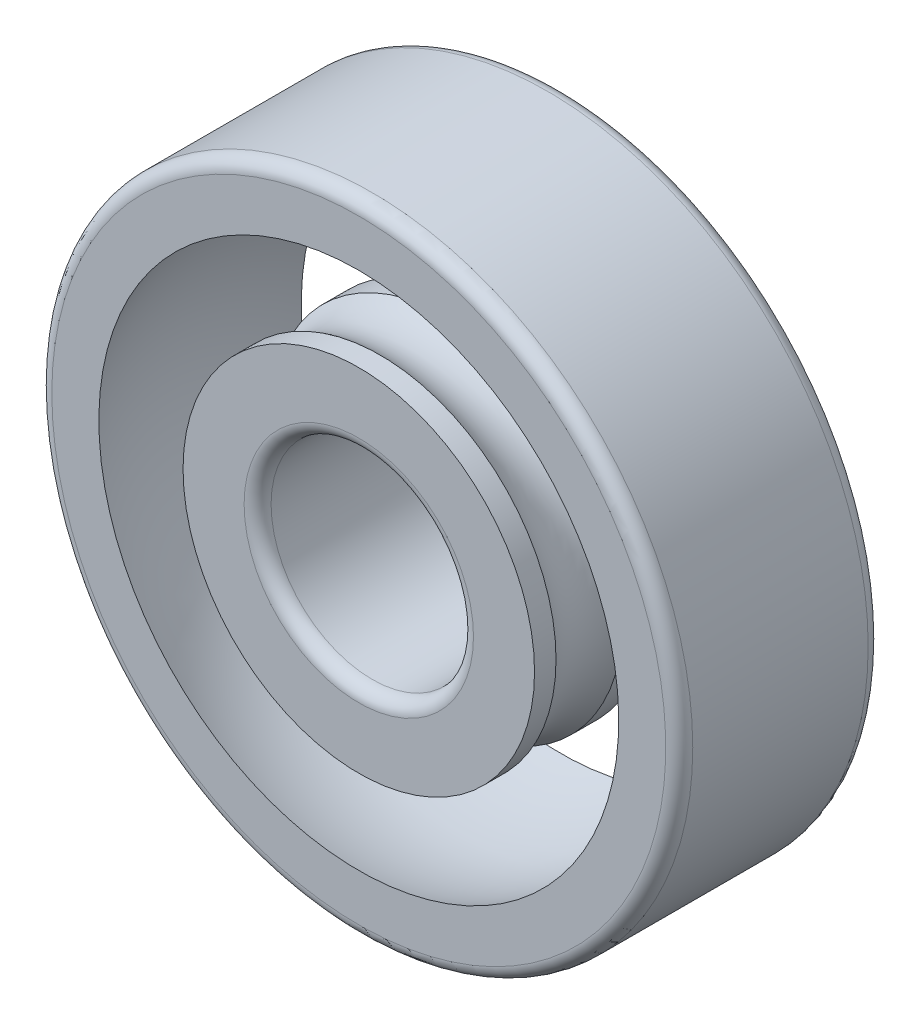
from build123d import *

# Parameters (mm, degrees)
FILLET_1_R = 0.4
FILLET_2_R = 0.4


with BuildPart() as part:
    # Эскиз1 → Повернуть1 (revolve)
    with BuildSketch(Plane(origin=(0, 0, 0), x_dir=(0, 0, -1), z_dir=(1, 0, 0))):
        with BuildLine():
            Line((0, 5.21), (0.636807205, 5.21))
            ThreePointArc((0.636807205, 5.21), (1.625, 4.875), (2.613192795, 5.21))
            Line((2.613192795, 5.21), (3.386807205, 5.21))
            ThreePointArc((3.386807205, 5.21), (4.375, 4.875), (5.363192795, 5.21))
            Line((5.363192795, 5.21), (6, 5.21))
            Line((6, 5.21), (6, 3))
            Line((6, 3), (0, 3))
            Line((0, 3), (0, 5.21))
        make_face()
        with BuildLine():
            Line((0, 9.5), (6, 9.5))
            Line((6, 9.5), (6, 7.705435334))
            ThreePointArc((6, 7.705435334), (3, 8.268841133), (0, 7.705435334))
            Line((0, 7.705435334), (0, 9.5))
        make_face()
    revolve(axis=Axis((0, 0, 0), (0, 0, -1)))

    # Скругление1
    fillet_1_edges = [part.edges().sort_by_distance(p)[0] for p in [
        (0, -3, 0),
        (0, -3, -6),
    ]]
    fillet(fillet_1_edges, radius=FILLET_1_R)

    # Скругление2
    fillet_2_edges = [part.edges().sort_by_distance(p)[0] for p in [
        (0, -9.5, -6),
        (0, -9.5, 0),
    ]]
    fillet(fillet_2_edges, radius=FILLET_2_R)


solid = part.part
